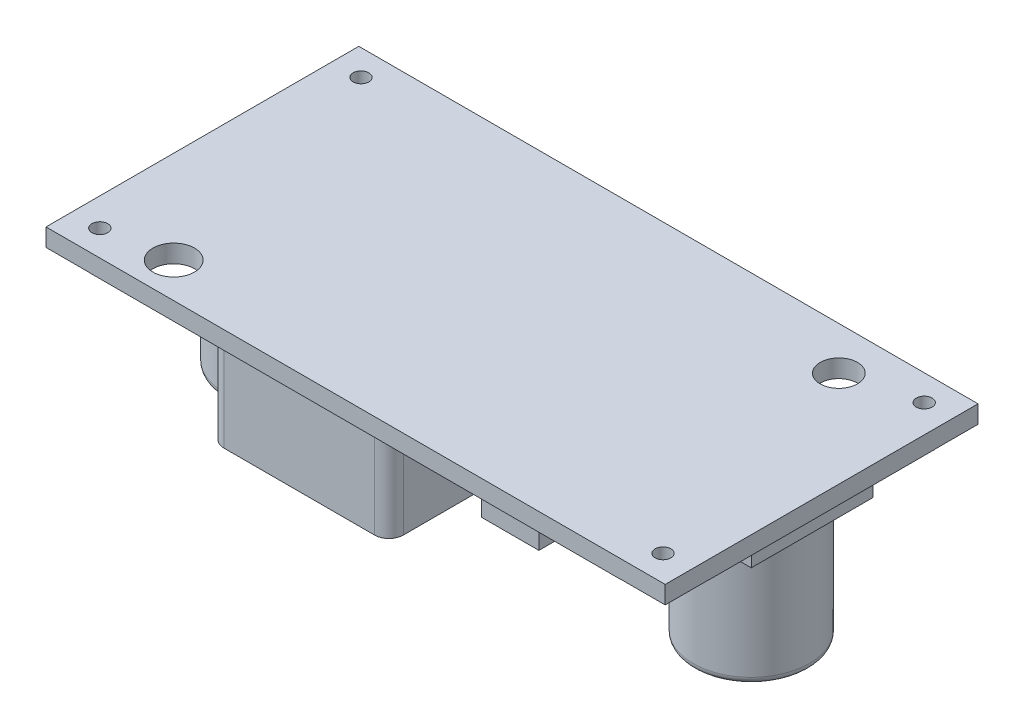
from build123d import *
from OCP.BRepFilletAPI import BRepFilletAPI_MakeChamfer

# Parameters (mm, degrees)
SKETCH1_W            = 43.15
SKETCH1_H            = 21.8
BOSS_EXTRUDE1_DEPTH  = 1.25
SKETCH2_R            = 0.55
CUT_EXTRUDE1_DEPTH   = 25.204403009
SKETCH3_R            = 1.3
SKETCH3_R_2          = 1.45
CUT_EXTRUDE2_DEPTH   = 25.204403009
SKETCH4_W            = 3
SKETCH4_H            = 3
CUT_EXTRUDE3_DEPTH   = 0.01
SKETCH5_W            = 0.089743589
SKETCH5_H            = 1
SKETCH5_W_2          = 0.384615385
SKETCH5_H_2          = 0.102564102
CUT_EXTRUDE4_DEPTH   = 0.01
SKETCH6_W            = 8.5
SKETCH6_H            = 8.5
BOSS_EXTRUDE2_DEPTH  = 1.75
SKETCH7_R            = 4.05
BOSS_EXTRUDE3_DEPTH  = 8.5
FILLET1_R            = 0.5
SKETCH8_W            = 12.5
SKETCH8_H            = 12.5
BOSS_EXTRUDE4_DEPTH  = 7.1
FILLET2_R            = 1
BOSS_EXTRUDE5_DEPTH  = 10
SKETCH10_W           = 4
SKETCH10_H           = 2.5
BOSS_EXTRUDE6_DEPTH  = 2.3
SKETCH11_W           = 10
SKETCH11_H           = 8.4
BOSS_EXTRUDE7_DEPTH  = 4.3
CHAMFER1_SIZE        = 2
CHAMFER1_SIZE2       = 0.727940469
SKETCH12_W           = 10
SKETCH12_H           = 1.5
BOSS_EXTRUDE8_DEPTH  = 1
SKETCH13_W           = 1
SKETCH13_H           = 5
BOSS_EXTRUDE9_DEPTH  = 1
LPATTERN1_COUNT      = 5
LPATTERN1_PITCH      = 1.9
SKETCH14_R           = 1.15
BOSS_EXTRUDE10_DEPTH = 1.6


with BuildPart() as part:
    # Sketch1 → Boss-Extrude1 (new body)
    with BuildSketch(Plane(origin=(0, 0, 0), x_dir=(1, 0, 0), z_dir=(0, 1, 0))):
        Rectangle(SKETCH1_W, SKETCH1_H)
    extrude(amount=BOSS_EXTRUDE1_DEPTH)

    # Sketch2 → Cut-Extrude1 (cut, through all)
    with BuildSketch(Plane(origin=(0, 1.25, 0), x_dir=(1, 0, 0), z_dir=(0, 1, 0))):
        with Locations((19.625, 9.1)):
            Circle(SKETCH2_R)
        with Locations((19.625, -9.1)):
            Circle(SKETCH2_R)
        with Locations((-19.625, 9.1)):
            Circle(SKETCH2_R)
        with Locations((-19.625, -9.1)):
            Circle(SKETCH2_R)
    extrude(amount=-CUT_EXTRUDE1_DEPTH, mode=Mode.SUBTRACT)

    # Sketch3 → Cut-Extrude2 (cut, through all)
    with BuildSketch(Plane(origin=(0, 1.25, 0), x_dir=(1, 0, 0), z_dir=(0, 1, 0))):
        with Locations((14.875, 7.9)):
            Circle(SKETCH3_R)
        with Locations((-15.125, -8.45)):
            Circle(SKETCH3_R_2)
    extrude(amount=-CUT_EXTRUDE2_DEPTH, mode=Mode.SUBTRACT)

    # Sketch4 → Cut-Extrude3 (cut)
    with BuildSketch(Plane.XZ):
        with Locations((20.075, -9.4)):
            Rectangle(SKETCH4_W, SKETCH4_H)
        with Locations((20.075, 9.4)):
            Rectangle(SKETCH4_W, SKETCH4_H)
        with Locations((-20.075, 9.4)):
            Rectangle(SKETCH4_W, SKETCH4_H)
        with Locations((-20.075, -9.4)):
            Rectangle(SKETCH4_W, SKETCH4_H)
    extrude(amount=-CUT_EXTRUDE3_DEPTH, mode=Mode.SUBTRACT)

    # Sketch5 → Cut-Extrude4 (cut)
    # profile 1 of 14: a face of its own
    with BuildSketch(Plane.XZ):
        with Locations((20.573564305, -7.20434754)):
            Rectangle(SKETCH5_W, SKETCH5_H)
    # profile 2 of 14: a face of its own
    with BuildSketch(Plane.XZ):
        Polygon((20.310743792, -6.70434754), (20.310743792, -7.70434754), (20.291913663, -7.70434754), (19.631256612, -6.917288246), (19.631256612, -7.70434754), (19.541513022, -7.70434754), (19.541513022, -6.70434754), (19.561945715, -6.70434754), (20.221000202, -7.489603951), (20.221000202, -6.70434754), align=None)
    # profile 3 of 14: a face of its own
    with BuildSketch(Plane.XZ):
        Polygon((19.041513022, -7.242809079), (19.041513022, -7.537680874), (18.951769433, -7.537680874), (18.951769433, -7.242809079), (18.656897638, -7.242809079), (18.656897638, -7.153065489), (18.951769433, -7.153065489), (18.951769433, -6.858193694), (19.041513022, -6.858193694), (19.041513022, -7.153065489), (19.336384817, -7.153065489), (19.336384817, -7.242809079), align=None)
    # profile 4 of 14: a face of its own
    with BuildSketch(Plane.XZ):
        with Locations((20.573564305, 7.050014745)):
            Rectangle(SKETCH5_W, SKETCH5_H)
    # profile 5 of 14: a face of its own
    with BuildSketch(Plane.XZ):
        Polygon((20.310743792, 7.550014745), (20.310743792, 6.550014745), (20.291913663, 6.550014745), (19.631256612, 7.337074039), (19.631256612, 6.550014745), (19.541513022, 6.550014745), (19.541513022, 7.550014745), (19.561945715, 7.550014745), (20.221000202, 6.764758334), (20.221000202, 7.550014745), align=None)
    # profile 6 of 14: a face of its own
    with BuildSketch(Plane.XZ):
        with Locations((19.182538664, 7.16539936)):
            Rectangle(SKETCH5_W_2, SKETCH5_H_2)
    # profile 7 of 14: a face of its own
    with BuildSketch(Plane.XZ):
        with BuildLine():
            add(Edge.make_bspline(
                [(-18.368582224, -7.729988566), (-18.38710084, -7.729527463), (-18.423472932, -7.728621818), (-18.476879134, -7.721460512), (-18.528017723, -7.709673427), (-18.576919243, -7.693028676), (-18.623393505, -7.671446786), (-18.667587441, -7.645245887), (-18.709349143, -7.614168476), (-18.748570597, -7.578952276), (-18.784219107, -7.540242315), (-18.815239087, -7.498684445), (-18.841639984, -7.45511511), (-18.86321046, -7.409250571), (-18.880159794, -7.361295598), (-18.891849075, -7.310964515), (-18.89931763, -7.258591548), (-18.900190639, -7.222869536), (-18.900633506, -7.204748181)],
                knots=[0, 0, 0, 0, 1.065027606, 2.091802087, 3.093458616, 4.079833113, 5.057734272, 6.036020118, 7.030157768, 8.047461502, 9.064242947, 10.052216774, 11.02588392, 11.989864716, 12.962978571, 13.945936472, 14.957997893, 16, 16, 16, 16], degree=3))
            add(Edge.make_bspline(
                [(-18.900633506, -7.204748181), (-18.90019049, -7.186760417), (-18.899317256, -7.15130445), (-18.891843006, -7.099262352), (-18.880107666, -7.04924053), (-18.863420139, -7.001355329), (-18.841833774, -6.955583238), (-18.815391336, -6.911983419), (-18.784441048, -6.870304371), (-18.748938698, -6.831405973), (-18.710169843, -6.795754174), (-18.668868728, -6.764237449), (-18.625085193, -6.737982209), (-18.579502591, -6.716089273), (-18.531667274, -6.699508299), (-18.481916612, -6.687425442), (-18.429968515, -6.680032155), (-18.394581428, -6.679153244), (-18.376595044, -6.678706515)],
                knots=[0, 0, 0, 0, 1.043683505, 2.0572211, 3.045299494, 4.022276905, 4.994977706, 5.977452478, 6.97747046, 8.003698437, 9.029677512, 10.031249186, 11.013723958, 11.988083691, 12.9614021, 13.946617861, 14.956316495, 16, 16, 16, 16], degree=3))
            add(Edge.make_bspline(
                [(-18.376595044, -6.678706515), (-18.358473775, -6.679149137), (-18.322751929, -6.680021664), (-18.270313284, -6.687502917), (-18.219946351, -6.699197309), (-18.171806209, -6.715925718), (-18.125877061, -6.737463833), (-18.082163349, -6.763930978), (-18.040612543, -6.795118874), (-18.001647471, -6.830593343), (-17.966038663, -6.869287857), (-17.93471866, -6.910534742), (-17.908404103, -6.953941717), (-17.886856896, -6.99932985), (-17.869813875, -7.04658182), (-17.85818285, -7.09599486), (-17.850658584, -7.147292082), (-17.849791445, -7.182218594), (-17.849351454, -7.199940489)],
                knots=[0, 0, 0, 0, 1.053167129, 2.076072758, 3.073341244, 4.055601477, 5.033424535, 6.017524495, 7.021518915, 8.049444456, 9.077120685, 10.074910483, 11.055688766, 12.022980584, 12.991883888, 13.970269434, 14.970104079, 16, 16, 16, 16], degree=3))
            add(Edge.make_bspline(
                [(-17.849351454, -7.199940489), (-17.849504067, -7.211835592), (-17.849807368, -7.235475735), (-17.853464198, -7.270579678), (-17.858759817, -7.305122864), (-17.866388969, -7.338989175), (-17.876229927, -7.372184142), (-17.888357238, -7.404639879), (-17.902255142, -7.436623726), (-17.918802516, -7.467526974), (-17.936856197, -7.497398127), (-17.956541921, -7.525863672), (-17.977996948, -7.552415137), (-18.000914797, -7.577479162), (-18.025612702, -7.60062796), (-18.051718962, -7.622366229), (-18.079370174, -7.642468942), (-18.108610072, -7.660513888), (-18.138693172, -7.677088389), (-18.169837729, -7.690926734), (-18.201386624, -7.703157975), (-18.233617752, -7.712878184), (-18.266456557, -7.720613585), (-18.299944091, -7.725869594), (-18.334045863, -7.729534549), (-18.357020572, -7.729836576), (-18.368582224, -7.729988566)],
                knots=[0, 0, 0, 0, 1.037115869, 2.061148057, 3.07517727, 4.084041727, 5.086514338, 6.092668487, 7.104487461, 8.125783165, 9.147610153, 10.147694368, 11.141876323, 12.122903372, 13.107606018, 14.091946891, 15.084523921, 16.086505767, 17.087268121, 18.077809654, 19.05670789, 20.036870126, 21.011670792, 21.99694167, 22.991993299, 24, 24, 24, 24], degree=3))
        make_face()
        with BuildLine():
            add(Edge.make_bspline(
                [(-18.372989275, -7.627424463), (-18.363499236, -7.627309239), (-18.344609885, -7.627079893), (-18.316530705, -7.624040047), (-18.288810757, -7.619742766), (-18.26151094, -7.613485632), (-18.234606841, -7.605468265), (-18.208068597, -7.595567965), (-18.18187251, -7.584010035), (-18.156258128, -7.570593876), (-18.131634524, -7.555555754), (-18.107853744, -7.539700581), (-18.085824005, -7.522129706), (-18.065119795, -7.503494722), (-18.045791345, -7.483539051), (-18.027836073, -7.462409697), (-18.011271668, -7.440011003), (-17.996296681, -7.416436295), (-17.982970153, -7.391816886), (-17.971038343, -7.366623478), (-17.96114733, -7.340559972), (-17.953312174, -7.31378902), (-17.946661922, -7.286428592), (-17.942490391, -7.25832962), (-17.939421421, -7.229588972), (-17.939204674, -7.210165474), (-17.939095044, -7.20034113)],
                knots=[0, 0, 0, 0, 1.008431664, 2.007222653, 2.999229743, 3.989431819, 4.982149843, 5.98167215, 6.998687425, 8.024288174, 9.053028776, 10.065052016, 11.06063401, 12.045759335, 13.024701188, 14.011819507, 14.991481775, 15.984022113, 16.97831254, 17.965966747, 18.945551853, 19.938269878, 20.93007375, 21.936103907, 22.956087853, 24, 24, 24, 24], degree=3))
            add(Edge.make_bspline(
                [(-17.939095044, -7.20034113), (-17.939460124, -7.18589511), (-17.940178348, -7.157475319), (-17.946440049, -7.115822591), (-17.956161959, -7.075753585), (-17.970256891, -7.037507125), (-17.988237759, -7.000912661), (-18.010170767, -6.966112605), (-18.036256775, -6.933117223), (-18.065870762, -6.902172133), (-18.098252876, -6.873938567), (-18.132621434, -6.849121115), (-18.168704526, -6.828234054), (-18.206294178, -6.810772941), (-18.245711323, -6.797618465), (-18.286703235, -6.78823933), (-18.329270818, -6.782160446), (-18.35827816, -6.781570042), (-18.372989275, -6.781270617)],
                knots=[0, 0, 0, 0, 1.032022337, 2.030307203, 3.003823408, 3.974715386, 4.937372378, 5.913284036, 6.909147208, 7.938749767, 8.970518239, 9.975863271, 10.963918693, 11.946286286, 12.933361397, 13.927862637, 14.949112547, 16, 16, 16, 16], degree=3))
            add(Edge.make_bspline(
                [(-18.372989275, -6.781270617), (-18.382877743, -6.781406366), (-18.402489546, -6.781675596), (-18.43165912, -6.784391115), (-18.460305908, -6.788737028), (-18.488376886, -6.795025268), (-18.515909176, -6.802790779), (-18.542818434, -6.812424594), (-18.569100478, -6.823967656), (-18.594866621, -6.836852657), (-18.619558769, -6.851384521), (-18.642896516, -6.867351479), (-18.665033336, -6.884326002), (-18.685699755, -6.902826032), (-18.704947512, -6.922613368), (-18.722581883, -6.943832117), (-18.739138565, -6.966063017), (-18.754008519, -6.989631733), (-18.767517861, -7.014056337), (-18.779099158, -7.039323086), (-18.788995854, -7.065271951), (-18.79697217, -7.091928539), (-18.803226038, -7.119231138), (-18.807534348, -7.147219297), (-18.810548252, -7.175836215), (-18.810775408, -7.195191607), (-18.810889916, -7.204948502)],
                knots=[0, 0, 0, 0, 1.047362266, 2.077233941, 3.100744636, 4.115120168, 5.122788643, 6.129711893, 7.140355774, 8.162227187, 9.180148637, 10.17298275, 11.156396779, 12.133377858, 13.108923632, 14.078087502, 15.054351192, 16.043448276, 17.028082865, 18.009331763, 18.985518559, 19.968016174, 20.954783108, 21.950335389, 22.966780876, 24, 24, 24, 24], degree=3))
            add(Edge.make_bspline(
                [(-18.810889916, -7.204948502), (-18.810775312, -7.214638646), (-18.810547975, -7.233860832), (-18.807535839, -7.262278208), (-18.803221299, -7.29006484), (-18.797003382, -7.317111641), (-18.788989053, -7.343425506), (-18.779106957, -7.368981718), (-18.767454019, -7.393875494), (-18.754080225, -7.41804527), (-18.73904719, -7.441238137), (-18.722620051, -7.463409943), (-18.704516458, -7.484146175), (-18.685248916, -7.503951738), (-18.664354196, -7.522430498), (-18.641828634, -7.539510993), (-18.618233153, -7.555963051), (-18.593033905, -7.570522608), (-18.56712142, -7.584038293), (-18.54050506, -7.595559652), (-18.513517662, -7.605512241), (-18.48612318, -7.613451103), (-18.458368938, -7.619748844), (-18.430247222, -7.62403849), (-18.401768476, -7.627080219), (-18.382612784, -7.627309351), (-18.372989275, -7.627424463)],
                knots=[0, 0, 0, 0, 1.02988216, 2.042960975, 3.035124439, 4.018561492, 4.99104521, 5.957523397, 6.929462691, 7.91146347, 8.892205782, 9.866320947, 10.842813644, 11.816825305, 12.802668543, 13.805243666, 14.821427616, 15.858893029, 16.897256944, 17.927432741, 18.940436917, 19.95373962, 20.957947499, 21.96413624, 22.977215056, 24, 24, 24, 24], degree=3))
        make_face(mode=Mode.SUBTRACT)
    # profile 8 of 14: a face of its own
    with BuildSketch(Plane.XZ):
        with BuildLine():
            Line((-19.105761711, -7.70434754), (-19.195505301, -7.70434754))
            Line((-19.195505301, -7.70434754), (-19.195505301, -7.105188887))
            add(Edge.make_bspline(
                [(-19.195505301, -7.105188887), (-19.195491945, -7.096708676), (-19.195466601, -7.080616016), (-19.195635891, -7.057710787), (-19.196109996, -7.037347228), (-19.196408899, -7.019446843), (-19.197073851, -7.004091772), (-19.19761615, -6.991198826), (-19.198313452, -6.980829054), (-19.199151486, -6.974777361), (-19.199511711, -6.972176066)],
                knots=[0, 0, 0, 0, 1.528628734, 2.90083645, 4.128790002, 5.200304208, 6.127813768, 6.898992206, 7.526736466, 8, 8, 8, 8], degree=3))
            add(Edge.make_bspline(
                [(-19.199511711, -6.972176066), (-19.200972681, -6.96271849), (-19.203793018, -6.944461064), (-19.211313216, -6.918494388), (-19.221256895, -6.894967818), (-19.233929246, -6.873618494), (-19.249558961, -6.854296305), (-19.268842928, -6.836815483), (-19.291741344, -6.821125667), (-19.317733544, -6.80736291), (-19.345445382, -6.795948363), (-19.373862777, -6.787403151), (-19.402442881, -6.782174425), (-19.421579401, -6.78157051), (-19.431082224, -6.781270617)],
                knots=[0, 0, 0, 0, 1.042923073, 2.013316119, 2.939979093, 3.821796737, 4.712412725, 5.640305549, 6.650442997, 7.732186751, 8.842579391, 9.91407549, 10.964170509, 12, 12, 12, 12], degree=3))
            add(Edge.make_bspline(
                [(-19.431082224, -6.781270617), (-19.439241167, -6.781575714), (-19.45551193, -6.782184145), (-19.479674294, -6.785998708), (-19.503282475, -6.792736533), (-19.526145917, -6.801919655), (-19.547912015, -6.813194438), (-19.567995575, -6.82679489), (-19.586185097, -6.842406149), (-19.602588639, -6.859955077), (-19.616866421, -6.879549214), (-19.629157428, -6.901086474), (-19.639199831, -6.924738634), (-19.644244776, -6.941407341), (-19.646827416, -6.949940489)],
                knots=[0, 0, 0, 0, 0.994543961, 1.983343699, 2.972712664, 3.980751554, 4.981834161, 5.954730495, 6.930176574, 7.89761099, 8.875938748, 9.87834379, 10.913868493, 12, 12, 12, 12], degree=3))
            add(Edge.make_bspline(
                [(-19.646827416, -6.949940489), (-19.647684595, -6.953468653), (-19.649594734, -6.961330825), (-19.651379604, -6.974622622), (-19.653238611, -6.990305297), (-19.654528488, -7.00849153), (-19.65578598, -7.029120379), (-19.656538286, -7.05229931), (-19.65688601, -7.077944156), (-19.656989633, -7.095840488), (-19.657043762, -7.105188887)],
                knots=[0, 0, 0, 0, 0.558680831, 1.244966039, 2.062412453, 2.990489873, 4.051219941, 5.244515665, 6.560634259, 8, 8, 8, 8], degree=3))
            Line((-19.657043762, -7.105188887), (-19.657043762, -7.70434754))
            Line((-19.657043762, -7.70434754), (-19.746787352, -7.70434754))
            Line((-19.746787352, -7.70434754), (-19.746787352, -7.100381194))
            add(Edge.make_bspline(
                [(-19.746787352, -7.100381194), (-19.746715538, -7.089495828), (-19.74657539, -7.068252374), (-19.745335645, -7.037125015), (-19.743415396, -7.007589937), (-19.740514726, -6.979684293), (-19.737305158, -6.95337668), (-19.732751804, -6.928763453), (-19.727909438, -6.905635808), (-19.721832335, -6.883951083), (-19.714603283, -6.863382087), (-19.705994517, -6.84354031), (-19.695509531, -6.824604275), (-19.683641199, -6.806226848), (-19.670146527, -6.788577391), (-19.655140581, -6.771518947), (-19.638383184, -6.755275772), (-19.620296672, -6.739770211), (-19.601027889, -6.725247988), (-19.580360656, -6.712883506), (-19.558664921, -6.702419257), (-19.536170782, -6.693506591), (-19.512498053, -6.686989185), (-19.487941602, -6.682096021), (-19.462328846, -6.679327946), (-19.444910587, -6.678915415), (-19.436090236, -6.678706515)],
                knots=[0, 0, 0, 0, 1.316485072, 2.56920066, 3.767172097, 4.895413872, 5.962239305, 6.971350037, 7.921780903, 8.819233545, 9.69278517, 10.557066787, 11.431700348, 12.307563454, 13.200791052, 14.11626757, 15.05287325, 16.020813301, 16.99640464, 17.967304965, 18.928075993, 19.907403966, 20.889159767, 21.893313923, 22.933205135, 24, 24, 24, 24], degree=3))
            add(Edge.make_bspline(
                [(-19.436090236, -6.678706515), (-19.426470423, -6.678930578), (-19.407596382, -6.679370189), (-19.379786501, -6.681893176), (-19.353121676, -6.686633269), (-19.327341664, -6.692707929), (-19.302695531, -6.700949216), (-19.279190538, -6.711075559), (-19.256556799, -6.722636319), (-19.235304248, -6.736297179), (-19.215258543, -6.751193427), (-19.19704158, -6.767555322), (-19.18019092, -6.78475972), (-19.165449304, -6.803454452), (-19.152259153, -6.823256821), (-19.14091112, -6.844259965), (-19.131163556, -6.86643573), (-19.126133233, -6.881851051), (-19.123590236, -6.889644015)],
                knots=[0, 0, 0, 0, 1.138939089, 2.234594419, 3.301501784, 4.342532435, 5.367382236, 6.373123747, 7.370098489, 8.372230273, 9.360297234, 10.323289009, 11.268038109, 12.20748145, 13.137029304, 14.081414587, 15.030090602, 16, 16, 16, 16], degree=3))
            add(Edge.make_bspline(
                [(-19.123590236, -6.889644015), (-19.122111048, -6.894967607), (-19.118902657, -6.906514599), (-19.115466857, -6.925625024), (-19.112578548, -6.947629286), (-19.109862674, -6.972528891), (-19.108260115, -7.000343139), (-19.106855132, -7.031059972), (-19.105751813, -7.064716533), (-19.105758319, -7.08816068), (-19.105761711, -7.100381194)],
                knots=[0, 0, 0, 0, 0.625038921, 1.35572334, 2.194682327, 3.136881307, 4.189498639, 5.346923369, 6.617055217, 8, 8, 8, 8], degree=3))
            Line((-19.105761711, -7.100381194), (-19.105761711, -7.70434754))
        make_face()
    # profile 9 of 14: a face of its own
    with BuildSketch(Plane.XZ):
        Polygon((-19.900633506, -7.601783438), (-19.900633506, -7.70434754), (-20.426274531, -7.70434754), (-20.426274531, -7.601783438), (-20.208325813, -7.601783438), (-20.208325813, -6.70434754), (-20.118582224, -6.70434754), (-20.118582224, -7.601783438), align=None)
    # profile 10 of 14: a face of its own
    with BuildSketch(Plane.XZ):
        Polygon((-20.849351454, -7.242809079), (-20.849351454, -7.537680874), (-20.939095044, -7.537680874), (-20.939095044, -7.242809079), (-21.233966839, -7.242809079), (-21.233966839, -7.153065489), (-20.939095044, -7.153065489), (-20.939095044, -6.858193694), (-20.849351454, -6.858193694), (-20.849351454, -7.153065489), (-20.554479659, -7.153065489), (-20.554479659, -7.242809079), align=None)
    # profile 11 of 14: a face of its own
    with BuildSketch(Plane.XZ):
        with BuildLine():
            add(Edge.make_bspline(
                [(-18.368582224, 6.524373719), (-18.38710084, 6.524834822), (-18.423472932, 6.525740467), (-18.476879134, 6.532901773), (-18.528017723, 6.544688858), (-18.576919243, 6.561333609), (-18.623393505, 6.582915499), (-18.667587441, 6.609116398), (-18.709349143, 6.640193809), (-18.748570597, 6.675410009), (-18.784219107, 6.71411997), (-18.815239087, 6.75567784), (-18.841639984, 6.799247175), (-18.86321046, 6.845111714), (-18.880159794, 6.893066687), (-18.891849075, 6.94339777), (-18.89931763, 6.995770737), (-18.900190639, 7.031492749), (-18.900633506, 7.049614104)],
                knots=[0, 0, 0, 0, 1.065027606, 2.091802087, 3.093458616, 4.079833113, 5.057734272, 6.036020118, 7.030157768, 8.047461502, 9.064242947, 10.052216774, 11.02588392, 11.989864716, 12.962978571, 13.945936472, 14.957997893, 16, 16, 16, 16], degree=3))
            add(Edge.make_bspline(
                [(-18.900633506, 7.049614104), (-18.90019049, 7.067601868), (-18.899317256, 7.103057835), (-18.891843006, 7.155099933), (-18.880107666, 7.205121755), (-18.863420139, 7.253006955), (-18.841833774, 7.298779047), (-18.815391336, 7.342378866), (-18.784441048, 7.384057914), (-18.748938698, 7.422956312), (-18.710169843, 7.458608111), (-18.668868728, 7.490124836), (-18.625085193, 7.516380076), (-18.579502591, 7.538273012), (-18.531667274, 7.554853986), (-18.481916612, 7.566936843), (-18.429968515, 7.57433013), (-18.394581428, 7.575209041), (-18.376595044, 7.57565577)],
                knots=[0, 0, 0, 0, 1.043683505, 2.0572211, 3.045299494, 4.022276905, 4.994977706, 5.977452478, 6.97747046, 8.003698437, 9.029677512, 10.031249186, 11.013723958, 11.988083691, 12.9614021, 13.946617861, 14.956316495, 16, 16, 16, 16], degree=3))
            add(Edge.make_bspline(
                [(-18.376595044, 7.57565577), (-18.358473775, 7.575213148), (-18.322751929, 7.574340621), (-18.270313284, 7.566859368), (-18.219946351, 7.555164976), (-18.171806209, 7.538436567), (-18.125877061, 7.516898452), (-18.082163349, 7.490431307), (-18.040612543, 7.459243411), (-18.001647471, 7.423768942), (-17.966038663, 7.385074428), (-17.93471866, 7.343827542), (-17.908404103, 7.300420568), (-17.886856896, 7.255032435), (-17.869813875, 7.207780465), (-17.85818285, 7.158367425), (-17.850658584, 7.107070203), (-17.849791445, 7.072143691), (-17.849351454, 7.054421796)],
                knots=[0, 0, 0, 0, 1.053167129, 2.076072758, 3.073341244, 4.055601477, 5.033424535, 6.017524495, 7.021518915, 8.049444456, 9.077120685, 10.074910483, 11.055688766, 12.022980584, 12.991883888, 13.970269434, 14.970104079, 16, 16, 16, 16], degree=3))
            add(Edge.make_bspline(
                [(-17.849351454, 7.054421796), (-17.849504067, 7.042526693), (-17.849807368, 7.01888655), (-17.853464198, 6.983782607), (-17.858759817, 6.949239421), (-17.866388969, 6.91537311), (-17.876229927, 6.882178143), (-17.888357238, 6.849722406), (-17.902255142, 6.817738559), (-17.918802516, 6.786835311), (-17.936856197, 6.756964158), (-17.956541921, 6.728498613), (-17.977996948, 6.701947148), (-18.000914797, 6.676883123), (-18.025612702, 6.653734325), (-18.051718962, 6.631996056), (-18.079370174, 6.611893343), (-18.108610072, 6.593848397), (-18.138693172, 6.577273896), (-18.169837729, 6.563435551), (-18.201386624, 6.55120431), (-18.233617752, 6.541484101), (-18.266456557, 6.5337487), (-18.299944091, 6.528492691), (-18.334045863, 6.524827736), (-18.357020572, 6.524525709), (-18.368582224, 6.524373719)],
                knots=[0, 0, 0, 0, 1.037115869, 2.061148057, 3.07517727, 4.084041727, 5.086514338, 6.092668487, 7.104487461, 8.125783165, 9.147610153, 10.147694368, 11.141876323, 12.122903372, 13.107606018, 14.091946891, 15.084523921, 16.086505767, 17.087268121, 18.077809654, 19.05670789, 20.036870126, 21.011670792, 21.99694167, 22.991993299, 24, 24, 24, 24], degree=3))
        make_face()
        with BuildLine():
            add(Edge.make_bspline(
                [(-18.372989275, 6.626937821), (-18.363499236, 6.627053046), (-18.344609885, 6.627282392), (-18.316530705, 6.630322238), (-18.288810757, 6.634619519), (-18.26151094, 6.640876653), (-18.234606841, 6.64889402), (-18.208068597, 6.65879432), (-18.18187251, 6.67035225), (-18.156258128, 6.683768409), (-18.131634524, 6.698806531), (-18.107853744, 6.714661704), (-18.085824005, 6.732232579), (-18.065119795, 6.750867563), (-18.045791345, 6.770823234), (-18.027836073, 6.791952588), (-18.011271668, 6.814351282), (-17.996296681, 6.83792599), (-17.982970153, 6.862545399), (-17.971038343, 6.887738807), (-17.96114733, 6.913802313), (-17.953312174, 6.940573265), (-17.946661922, 6.967933693), (-17.942490391, 6.996032665), (-17.939421421, 7.024773313), (-17.939204674, 7.044196811), (-17.939095044, 7.054021155)],
                knots=[0, 0, 0, 0, 1.008431664, 2.007222653, 2.999229743, 3.989431819, 4.982149843, 5.98167215, 6.998687425, 8.024288174, 9.053028776, 10.065052016, 11.06063401, 12.045759335, 13.024701188, 14.011819507, 14.991481775, 15.984022113, 16.97831254, 17.965966747, 18.945551853, 19.938269878, 20.93007375, 21.936103907, 22.956087853, 24, 24, 24, 24], degree=3))
            add(Edge.make_bspline(
                [(-17.939095044, 7.054021155), (-17.939460124, 7.068467175), (-17.940178348, 7.096886966), (-17.946440049, 7.138539694), (-17.956161959, 7.1786087), (-17.970256891, 7.21685516), (-17.988237759, 7.253449624), (-18.010170767, 7.28824968), (-18.036256775, 7.321245062), (-18.065870762, 7.352190152), (-18.098252876, 7.380423718), (-18.132621434, 7.40524117), (-18.168704526, 7.426128231), (-18.206294178, 7.443589344), (-18.245711323, 7.45674382), (-18.286703235, 7.466122955), (-18.329270818, 7.472201839), (-18.35827816, 7.472792243), (-18.372989275, 7.473091668)],
                knots=[0, 0, 0, 0, 1.032022337, 2.030307203, 3.003823408, 3.974715386, 4.937372378, 5.913284036, 6.909147208, 7.938749767, 8.970518239, 9.975863271, 10.963918693, 11.946286286, 12.933361397, 13.927862637, 14.949112547, 16, 16, 16, 16], degree=3))
            add(Edge.make_bspline(
                [(-18.372989275, 7.473091668), (-18.382877743, 7.472955919), (-18.402489546, 7.472686689), (-18.43165912, 7.46997117), (-18.460305908, 7.465625257), (-18.488376886, 7.459337017), (-18.515909176, 7.451571506), (-18.542818434, 7.441937691), (-18.569100478, 7.430394629), (-18.594866621, 7.417509628), (-18.619558769, 7.402977764), (-18.642896516, 7.387010806), (-18.665033336, 7.370036283), (-18.685699755, 7.351536253), (-18.704947512, 7.331748917), (-18.722581883, 7.310530168), (-18.739138565, 7.288299268), (-18.754008519, 7.264730552), (-18.767517861, 7.240305948), (-18.779099158, 7.215039199), (-18.788995854, 7.189090334), (-18.79697217, 7.162433746), (-18.803226038, 7.135131147), (-18.807534348, 7.107142988), (-18.810548252, 7.07852607), (-18.810775408, 7.059170678), (-18.810889916, 7.049413783)],
                knots=[0, 0, 0, 0, 1.047362266, 2.077233941, 3.100744636, 4.115120168, 5.122788643, 6.129711893, 7.140355774, 8.162227187, 9.180148637, 10.17298275, 11.156396779, 12.133377858, 13.108923632, 14.078087502, 15.054351192, 16.043448276, 17.028082865, 18.009331763, 18.985518559, 19.968016174, 20.954783108, 21.950335389, 22.966780876, 24, 24, 24, 24], degree=3))
            add(Edge.make_bspline(
                [(-18.810889916, 7.049413783), (-18.810775312, 7.039723639), (-18.810547975, 7.020501453), (-18.807535839, 6.992084077), (-18.803221299, 6.964297445), (-18.797003382, 6.937250644), (-18.788989053, 6.910936779), (-18.779106957, 6.885380567), (-18.767454019, 6.860486791), (-18.754080225, 6.836317015), (-18.73904719, 6.813124148), (-18.722620051, 6.790952342), (-18.704516458, 6.77021611), (-18.685248916, 6.750410546), (-18.664354196, 6.731931787), (-18.641828634, 6.714851292), (-18.618233153, 6.698399234), (-18.593033905, 6.683839677), (-18.56712142, 6.670323992), (-18.54050506, 6.658802633), (-18.513517662, 6.648850044), (-18.48612318, 6.640911182), (-18.458368938, 6.634613441), (-18.430247222, 6.630323795), (-18.401768476, 6.627282066), (-18.382612784, 6.627052934), (-18.372989275, 6.626937821)],
                knots=[0, 0, 0, 0, 1.02988216, 2.042960975, 3.035124439, 4.018561492, 4.99104521, 5.957523397, 6.929462691, 7.91146347, 8.892205782, 9.866320947, 10.842813644, 11.816825305, 12.802668543, 13.805243666, 14.821427616, 15.858893029, 16.897256944, 17.927432741, 18.940436917, 19.95373962, 20.957947499, 21.96413624, 22.977215056, 24, 24, 24, 24], degree=3))
        make_face(mode=Mode.SUBTRACT)
    # profile 12 of 14: a face of its own
    with BuildSketch(Plane.XZ):
        with BuildLine():
            Line((-19.105761711, 6.550014745), (-19.195505301, 6.550014745))
            Line((-19.195505301, 6.550014745), (-19.195505301, 7.149173398))
            add(Edge.make_bspline(
                [(-19.195505301, 7.149173398), (-19.195491945, 7.157653609), (-19.195466601, 7.173746269), (-19.195635891, 7.196651498), (-19.196109996, 7.217015057), (-19.196408899, 7.234915442), (-19.197073851, 7.250270513), (-19.19761615, 7.263163459), (-19.198313452, 7.273533231), (-19.199151486, 7.279584924), (-19.199511711, 7.282186219)],
                knots=[0, 0, 0, 0, 1.528628734, 2.90083645, 4.128790002, 5.200304208, 6.127813768, 6.898992206, 7.526736466, 8, 8, 8, 8], degree=3))
            add(Edge.make_bspline(
                [(-19.199511711, 7.282186219), (-19.200972681, 7.291643795), (-19.203793018, 7.309901221), (-19.211313216, 7.335867897), (-19.221256895, 7.359394467), (-19.233929246, 7.380743791), (-19.249558961, 7.40006598), (-19.268842928, 7.417546802), (-19.291741344, 7.433236618), (-19.317733544, 7.446999375), (-19.345445382, 7.458413922), (-19.373862777, 7.466959134), (-19.402442881, 7.47218786), (-19.421579401, 7.472791775), (-19.431082224, 7.473091668)],
                knots=[0, 0, 0, 0, 1.042923073, 2.013316119, 2.939979093, 3.821796737, 4.712412725, 5.640305549, 6.650442997, 7.732186751, 8.842579391, 9.91407549, 10.964170509, 12, 12, 12, 12], degree=3))
            add(Edge.make_bspline(
                [(-19.431082224, 7.473091668), (-19.439241167, 7.472786571), (-19.45551193, 7.47217814), (-19.479674294, 7.468363577), (-19.503282475, 7.461625751), (-19.526145917, 7.45244263), (-19.547912015, 7.441167847), (-19.567995575, 7.427567395), (-19.586185097, 7.411956136), (-19.602588639, 7.394407208), (-19.616866421, 7.374813071), (-19.629157428, 7.353275811), (-19.639199831, 7.329623651), (-19.644244776, 7.312954944), (-19.646827416, 7.304421796)],
                knots=[0, 0, 0, 0, 0.994543961, 1.983343699, 2.972712664, 3.980751554, 4.981834161, 5.954730495, 6.930176574, 7.89761099, 8.875938748, 9.87834379, 10.913868493, 12, 12, 12, 12], degree=3))
            add(Edge.make_bspline(
                [(-19.646827416, 7.304421796), (-19.647684595, 7.300893632), (-19.649594734, 7.29303146), (-19.651379604, 7.279739663), (-19.653238611, 7.264056988), (-19.654528488, 7.245870755), (-19.65578598, 7.225241906), (-19.656538286, 7.202062975), (-19.65688601, 7.176418129), (-19.656989633, 7.158521797), (-19.657043762, 7.149173398)],
                knots=[0, 0, 0, 0, 0.558680831, 1.244966039, 2.062412453, 2.990489873, 4.051219941, 5.244515665, 6.560634259, 8, 8, 8, 8], degree=3))
            Line((-19.657043762, 7.149173398), (-19.657043762, 6.550014745))
            Line((-19.657043762, 6.550014745), (-19.746787352, 6.550014745))
            Line((-19.746787352, 6.550014745), (-19.746787352, 7.153981091))
            add(Edge.make_bspline(
                [(-19.746787352, 7.153981091), (-19.746715538, 7.164866457), (-19.74657539, 7.186109911), (-19.745335645, 7.21723727), (-19.743415396, 7.246772348), (-19.740514726, 7.274677992), (-19.737305158, 7.300985605), (-19.732751804, 7.325598832), (-19.727909438, 7.348726477), (-19.721832335, 7.370411202), (-19.714603283, 7.390980198), (-19.705994517, 7.410821975), (-19.695509531, 7.42975801), (-19.683641199, 7.448135437), (-19.670146527, 7.465784894), (-19.655140581, 7.482843338), (-19.638383184, 7.499086513), (-19.620296672, 7.514592074), (-19.601027889, 7.529114297), (-19.580360656, 7.541478779), (-19.558664921, 7.551943028), (-19.536170782, 7.560855694), (-19.512498053, 7.5673731), (-19.487941602, 7.572266264), (-19.462328846, 7.575034339), (-19.444910587, 7.57544687), (-19.436090236, 7.57565577)],
                knots=[0, 0, 0, 0, 1.316485072, 2.56920066, 3.767172097, 4.895413872, 5.962239305, 6.971350037, 7.921780903, 8.819233545, 9.69278517, 10.557066787, 11.431700348, 12.307563454, 13.200791052, 14.11626757, 15.05287325, 16.020813301, 16.99640464, 17.967304965, 18.928075993, 19.907403966, 20.889159767, 21.893313923, 22.933205135, 24, 24, 24, 24], degree=3))
            add(Edge.make_bspline(
                [(-19.436090236, 7.57565577), (-19.426470423, 7.575431707), (-19.407596382, 7.574992096), (-19.379786501, 7.572469109), (-19.353121676, 7.567729016), (-19.327341664, 7.561654356), (-19.302695531, 7.553413069), (-19.279190538, 7.543286726), (-19.256556799, 7.531725966), (-19.235304248, 7.518065106), (-19.215258543, 7.503168858), (-19.19704158, 7.486806963), (-19.18019092, 7.469602565), (-19.165449304, 7.450907833), (-19.152259153, 7.431105464), (-19.14091112, 7.41010232), (-19.131163556, 7.387926555), (-19.126133233, 7.372511233), (-19.123590236, 7.36471827)],
                knots=[0, 0, 0, 0, 1.138939089, 2.234594419, 3.301501784, 4.342532435, 5.367382236, 6.373123747, 7.370098489, 8.372230273, 9.360297234, 10.323289009, 11.268038109, 12.20748145, 13.137029304, 14.081414587, 15.030090602, 16, 16, 16, 16], degree=3))
            add(Edge.make_bspline(
                [(-19.123590236, 7.36471827), (-19.122111048, 7.359394678), (-19.118902657, 7.347847686), (-19.115466857, 7.328737261), (-19.112578548, 7.306732999), (-19.109862674, 7.281833394), (-19.108260115, 7.254019146), (-19.106855132, 7.223302313), (-19.105751813, 7.189645752), (-19.105758319, 7.166201605), (-19.105761711, 7.153981091)],
                knots=[0, 0, 0, 0, 0.625038921, 1.35572334, 2.194682327, 3.136881307, 4.189498639, 5.346923369, 6.617055217, 8, 8, 8, 8], degree=3))
            Line((-19.105761711, 7.153981091), (-19.105761711, 6.550014745))
        make_face()
    # profile 13 of 14: a face of its own
    with BuildSketch(Plane.XZ):
        Polygon((-19.900633506, 6.652578847), (-19.900633506, 6.550014745), (-20.426274531, 6.550014745), (-20.426274531, 6.652578847), (-20.208325813, 6.652578847), (-20.208325813, 7.550014745), (-20.118582224, 7.550014745), (-20.118582224, 6.652578847), align=None)
    # profile 14 of 14: a face of its own
    with BuildSketch(Plane.XZ):
        with Locations((-20.708325814, 7.16539936)):
            Rectangle(SKETCH5_W_2, SKETCH5_H_2)
    extrude(amount=-CUT_EXTRUDE4_DEPTH, mode=Mode.SUBTRACT)

    # Sketch6 → Boss-Extrude2 (add)
    with BuildSketch(Plane.XZ):
        with Locations((16.325, -0.35)):
            Rectangle(SKETCH6_W, SKETCH6_H)
        with Locations((-16.325, -0.35)):
            Rectangle(SKETCH6_W, SKETCH6_H)
    extrude(amount=BOSS_EXTRUDE2_DEPTH)

    # Sketch7 → Boss-Extrude3 (add)
    with BuildSketch(Plane.XZ.offset(1.75)):
        with Locations((-16.325, -0.35)):
            Circle(SKETCH7_R)
        with Locations((16.325, -0.35)):
            Circle(SKETCH7_R)
    extrude(amount=BOSS_EXTRUDE3_DEPTH)

    # Fillet1
    fillet1_edges = [part.edges().sort_by_distance(p)[0] for p in [
        (12.275, -10.25, -0.35),
        (-20.375, -10.25, -0.35),
    ]]
    fillet(fillet1_edges, radius=FILLET1_R)

    # Sketch8 → Boss-Extrude4 (add)
    with BuildSketch(Plane.XZ):
        with Locations((-5.125, 3.45)):
            Rectangle(SKETCH8_W, SKETCH8_H)
    extrude(amount=BOSS_EXTRUDE4_DEPTH)

    # Fillet2
    fillet2_edges = [part.edges().sort_by_distance(p)[0] for p in [
        (-11.375, -3.55, -2.8),
        (1.125, -3.55, -2.8),
        (1.125, -3.55, 9.7),
        (-11.375, -3.55, 9.7),
    ]]
    fillet(fillet2_edges, radius=FILLET2_R)

    # Sketch9 → Boss-Extrude5 (add)
    with BuildSketch(Plane.XZ):
        Polygon((-10.225, -4.5), (-10.225, -5.2), (-2.125, -5.2), (-2.125, -4.5), (-1.425, -4.5), (-1.425, -9.5), (-10.925, -9.5), (-10.925, -4.5), align=None)
    extrude(amount=BOSS_EXTRUDE5_DEPTH)

    # Sketch10 → Boss-Extrude6 (add)
    with BuildSketch(Plane.XZ):
        with Locations((9.575, 8.45)):
            Rectangle(SKETCH10_W, SKETCH10_H)
    extrude(amount=BOSS_EXTRUDE6_DEPTH)

    # Sketch11 → Boss-Extrude7 (add)
    with BuildSketch(Plane.XZ):
        with Locations((6.625, -3.6)):
            Rectangle(SKETCH11_W, SKETCH11_H)
    extrude(amount=BOSS_EXTRUDE7_DEPTH)

    # Chamfer1: one chamfer whose edges measure the first distance from different faces: ONE call of the kernel's chamfer builder (chamfer() names one face for all edges)
    chamfer1_edges_1 = [part.edges().sort_by_distance(p)[0] for p in [
        (6.625, -4.3, 0.6),
    ]]
    chamfer1_side_1 = [part.faces().sort_by_distance(p)[0] for p in [
        (6.625, -2.15, 0.6),
    ]]
    chamfer1_edges_2 = [part.edges().sort_by_distance(p)[0] for p in [
        (6.625, -4.3, -7.8),
    ]]
    chamfer1_side_2 = [part.faces().sort_by_distance(p)[0] for p in [
        (6.625, -2.15, -7.8),
    ]]
    chamfer1 = BRepFilletAPI_MakeChamfer(part.part.solid().wrapped)
    for e in chamfer1_edges_1:
        chamfer1.Add(CHAMFER1_SIZE, CHAMFER1_SIZE2, e.wrapped, chamfer1_side_1[0].wrapped)  # the first distance lies on this face
    for e in chamfer1_edges_2:
        chamfer1.Add(CHAMFER1_SIZE, CHAMFER1_SIZE2, e.wrapped, chamfer1_side_2[0].wrapped)  # the first distance lies on this face
    add(Compound.cast(chamfer1.Shape()), mode=Mode.REPLACE)

    # Sketch12 → Boss-Extrude8 (add)
    with BuildSketch(Plane.XZ):
        with Locations((6.625, -8.55)):
            Rectangle(SKETCH12_W, SKETCH12_H)
    extrude(amount=BOSS_EXTRUDE8_DEPTH)

    # Sketch13 → Boss-Extrude9 (add)
    with BuildSketch(Plane.XZ):
        with Locations((2.875, 3.1)):
            Rectangle(SKETCH13_W, SKETCH13_H)
    boss_extrude9 = extrude(amount=BOSS_EXTRUDE9_DEPTH)

    # LPattern1: Boss-Extrude9 ×5
    with Locations(*[(i * LPATTERN1_PITCH, 0, 0) for i in range(1, LPATTERN1_COUNT)]):
        add(boss_extrude9)

    # Sketch14 → Boss-Extrude10 (add)
    with BuildSketch(Plane.XZ.offset(10)):
        with Locations((-2.575, -8.2)):
            Circle(SKETCH14_R)
    extrude(amount=BOSS_EXTRUDE10_DEPTH)


solid = part.part
